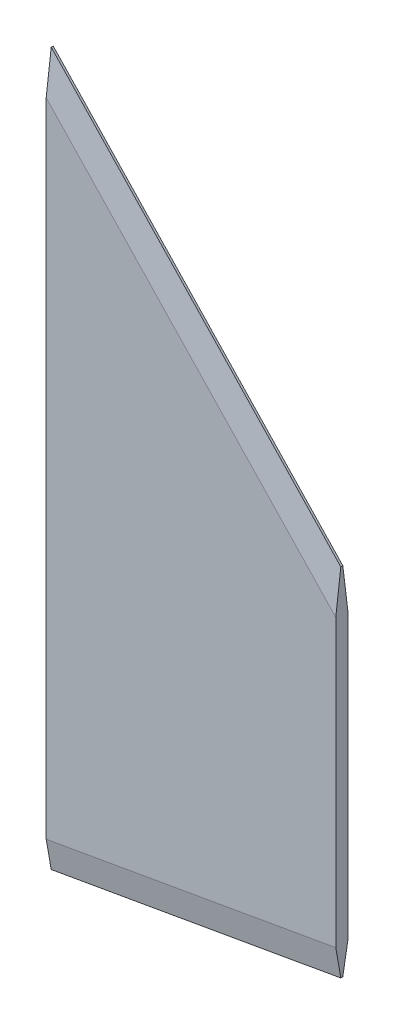
from build123d import *
from OCP.BRepFilletAPI import BRepFilletAPI_MakeChamfer

# Parameters (mm, degrees)
BOSS_EXTRUDE1_DEPTH = 1.5
CHAMFER1_SIZE       = 1.25
CHAMFER1_SIZE2      = 7.089102275


with BuildPart() as part:
    # Sketch1 → Boss-Extrude1 (new, symmetric)
    with BuildSketch(Plane.XY):
        Polygon((-60.98159975, 96.150770232), (-60.98159975, -81.649229768), (11.31315025, -68.949229768), (11.31315025, 19.950770232), align=None)
    extrude(amount=BOSS_EXTRUDE1_DEPTH, both=True)

    # Chamfer1: one chamfer whose edges measure the first distance from different faces: ONE call of the kernel's chamfer builder (chamfer() names one face for all edges)
    chamfer1_edges_1 = [part.edges().sort_by_distance(p)[0] for p in [
        (-24.83422475, -75.299229768, -1.5),
        (-24.83422475, -75.299229768, 1.5),
    ]]
    chamfer1_side_1 = [part.faces().sort_by_distance(p)[0] for p in [
        (-24.83422475, -75.299229768, 0),
    ]]
    chamfer1_edges_2 = [part.edges().sort_by_distance(p)[0] for p in [
        (-24.83422475, 58.050770232, -1.5),
        (-24.83422475, 58.050770232, 1.5),
    ]]
    chamfer1_side_2 = [part.faces().sort_by_distance(p)[0] for p in [
        (-24.83422475, 58.050770232, 0),
    ]]
    chamfer1 = BRepFilletAPI_MakeChamfer(part.part.solid().wrapped)
    for e in chamfer1_edges_1:
        chamfer1.Add(CHAMFER1_SIZE, CHAMFER1_SIZE2, e.wrapped, chamfer1_side_1[0].wrapped)  # the first distance lies on this face
    for e in chamfer1_edges_2:
        chamfer1.Add(CHAMFER1_SIZE, CHAMFER1_SIZE2, e.wrapped, chamfer1_side_2[0].wrapped)  # the first distance lies on this face
    add(Compound.cast(chamfer1.Shape()), mode=Mode.REPLACE)


solid = part.part
